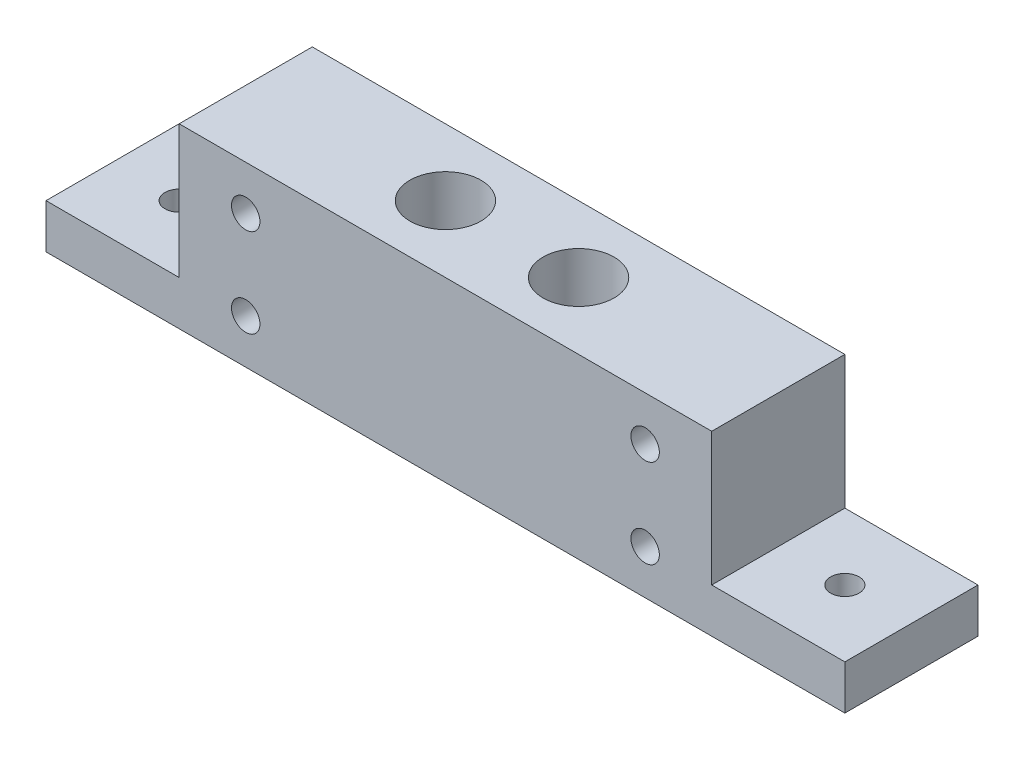
from build123d import *

# Parameters (mm, degrees)
SKETCH2_W           = 60
SKETCH2_H           = 15
SKETCH2_R           = 4
BOSS_EXTRUDE1_DEPTH = 10
SKETCH2_3_W         = 60
SKETCH2_3_H         = 15
BOSS_EXTRUDE2_DEPTH = 10
SKETCH4_R           = 1.6
CUT_EXTRUDE1_DEPTH  = 36
CUT_EXTRUDE2_START  = -6.25
SKETCH4_3_R         = 1.6
CUT_EXTRUDE2_DEPTH  = 2.5
SKETCH5_W           = 15
SKETCH5_H           = 15
BOSS_EXTRUDE3_DEPTH = 5
CUT_EXTRUDE3_REACH  = 51.812
SKETCH6_R           = 1.6


with BuildPart() as part:
    # Sketch2 → Boss-Extrude1 (new body)
    with BuildSketch(Plane(origin=(0, 0, 0), x_dir=(1, 0, 0), z_dir=(0, 1, 0))):
        Rectangle(SKETCH2_W, SKETCH2_H)
        with Locations((-7.5, 0)):
            Circle(SKETCH2_R, mode=Mode.SUBTRACT)
        with Locations((7.5, 0)):
            Circle(SKETCH2_R, mode=Mode.SUBTRACT)
    extrude(amount=BOSS_EXTRUDE1_DEPTH)

    # Sketch2<3> → Boss-Extrude2 (add)
    with BuildSketch(Plane(origin=(0, 0, 0), x_dir=(1, 0, 0), z_dir=(0, 1, 0))):
        Rectangle(SKETCH2_3_W, SKETCH2_3_H)
    extrude(amount=-BOSS_EXTRUDE2_DEPTH)

    # Sketch4 → Cut-Extrude1 (cut, through all)
    with BuildSketch(Plane.XY.offset(7.5)):
        with Locations((22.5, 5)):
            Circle(SKETCH4_R)
        with Locations((22.5, -5)):
            Circle(SKETCH4_R)
        with Locations((-22.5, -5)):
            Circle(SKETCH4_R)
        with Locations((-22.5, 5)):
            Circle(SKETCH4_R)
    extrude(amount=-CUT_EXTRUDE1_DEPTH, mode=Mode.SUBTRACT)

    # Sketch4<3> → Cut-Extrude2 (cut)
    # profile 1 of 4: a face of its own
    with BuildSketch(Plane.XY.offset(7.5).offset(CUT_EXTRUDE2_START)):
        Polygon((-22.5, 8.435234102), (-25.475, 6.717617051), (-25.475, 3.282382949), (-22.5, 1.564765898), (-19.525, 3.282382949), (-19.525, 6.717617051), align=None)
        with Locations((-22.5, 5)):
            Circle(SKETCH4_3_R, mode=Mode.SUBTRACT)
    # profile 2 of 4: a face of its own
    with BuildSketch(Plane.XY.offset(7.5).offset(CUT_EXTRUDE2_START)):
        Polygon((22.5, 8.435234102), (19.525, 6.717617051), (19.525, 3.282382949), (22.5, 1.564765898), (25.475, 3.282382949), (25.475, 6.717617051), align=None)
        with Locations((22.5, 5)):
            Circle(SKETCH4_3_R, mode=Mode.SUBTRACT)
    # profile 3 of 4: a face of its own
    with BuildSketch(Plane.XY.offset(7.5).offset(CUT_EXTRUDE2_START)):
        Polygon((-22.5, -8.435234102), (-19.525, -6.717617051), (-19.525, -3.282382949), (-22.5, -1.564765898), (-25.475, -3.282382949), (-25.475, -6.717617051), align=None)
        with Locations((-22.5, -5)):
            Circle(SKETCH4_3_R, mode=Mode.SUBTRACT)
    # profile 4 of 4: a face of its own
    with BuildSketch(Plane.XY.offset(7.5).offset(CUT_EXTRUDE2_START)):
        Polygon((22.5, -8.435234102), (25.475, -6.717617051), (25.475, -3.282382949), (22.5, -1.564765898), (19.525, -3.282382949), (19.525, -6.717617051), align=None)
        with Locations((22.5, -5)):
            Circle(SKETCH4_3_R, mode=Mode.SUBTRACT)
    extrude(amount=-CUT_EXTRUDE2_DEPTH, mode=Mode.SUBTRACT)

    # Sketch5 → Boss-Extrude3 (add)
    with BuildSketch(Plane.XZ.offset(10)):
        with Locations((-37.5, 0)):
            Rectangle(SKETCH5_W, SKETCH5_H)
        with Locations((37.5, 0)):
            Rectangle(SKETCH5_W, SKETCH5_H)
    extrude(amount=-BOSS_EXTRUDE3_DEPTH)

    # Sketch6 → Cut-Extrude3 (cut, up to next)
    with BuildSketch(Plane.XZ.offset(10), mode=Mode.PRIVATE) as cut_extrude3_sk1:
        with Locations((-37.5, 0)):
            Circle(SKETCH6_R)
    cut_extrude3_tool1 = extrude(cut_extrude3_sk1.sketch, amount=-CUT_EXTRUDE3_REACH, mode=Mode.PRIVATE) & part.part
    # Sketch6 → Cut-Extrude3 (cut, up to next)
    with BuildSketch(Plane.XZ.offset(10), mode=Mode.PRIVATE) as cut_extrude3_sk2:
        with Locations((37.5, 0)):
            Circle(SKETCH6_R)
    cut_extrude3_tool2 = extrude(cut_extrude3_sk2.sketch, amount=-CUT_EXTRUDE3_REACH, mode=Mode.PRIVATE) & part.part
    add(cut_extrude3_tool1.solids().sort_by_distance((-37.5, -10, 0))[0], mode=Mode.SUBTRACT)
    add(cut_extrude3_tool2.solids().sort_by_distance((37.5, -10, 0))[0], mode=Mode.SUBTRACT)


solid = part.part
